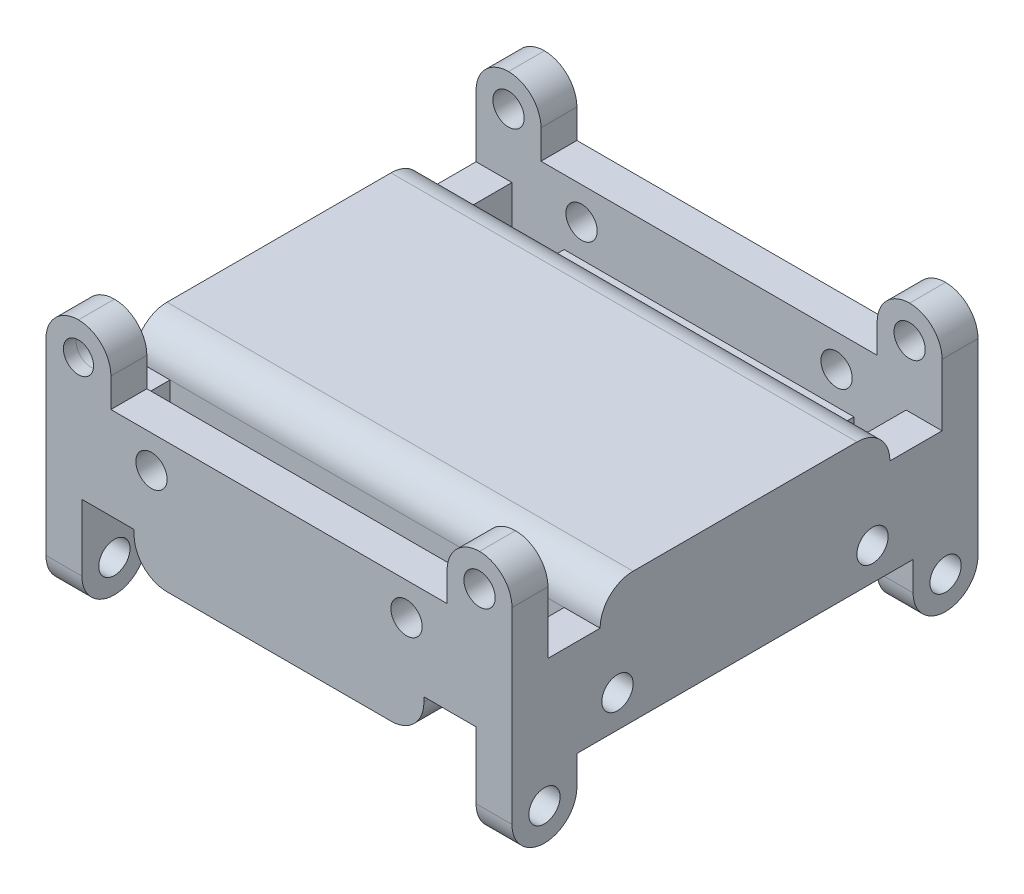
from build123d import *

# Parameters (mm, degrees)
ESBO_O1_R                  = 1.35
RESSALTO_EXTRUS_O1_DEPTH   = 2
ESBO_O3_W                  = 40.2
ESBO_O3_H                  = 2
RESSALTO_EXTRUS_O2_DEPTH   = 10.08
ESBO_O4_W                  = 3.1
ESBO_O4_H                  = 12.84
RESSALTO_EXTRUS_O3_DEPTH   = 34
CORTE_EXTRUS_O1_DEPTH      = 55.735280213
CORTE_EXTRUS_O1_DEPTH_BACK = 55.735280213
ESBO_O5_R                  = 1.35
ESBO_O7_W                  = 37.1
ESBO_O7_H                  = 3.24
CORTE_EXTRUS_O2_DEPTH      = 2
RESSALTO_EXTRUS_O5_START   = 2
ESBO_O12_R                 = 1.35
RESSALTO_EXTRUS_O5_DEPTH   = 2
ESBO_O18_W                 = 3.1
ESBO_O18_H                 = 3.24
RESSALTO_EXTRUS_O6_DEPTH   = 2
ESBO_O19_W                 = 3.1
ESBO_O19_H                 = 3.24
RESSALTO_EXTRUS_O7_DEPTH   = 2
ESBO_O21_R                 = 1.301764144
ESBO_O21_R_2               = 1.35
RESSALTO_EXTRUS_O8_DEPTH   = 1.1
RESSALTO_EXTRUS_O9_START   = 1.1
ESBO_O22_R                 = 1.35
RESSALTO_EXTRUS_O9_DEPTH   = 1.1
ESBO_O23_W                 = 3.1
ESBO_O23_H                 = 5.6
RESSALTO_EXTRUS_O10_DEPTH  = 5.85
CORTE_EXTRUS_O3_REACH      = 63.173
ESBO_O24_R                 = 1.35
ESBO_O25_W                 = 4.5
ESBO_O25_H                 = 3.1
CORTE_EXTRUS_O6_DEPTH      = 4.48
ESBO_O27_W                 = 3.1
ESBO_O27_H                 = 29
CORTE_EXTRUS_O7_DEPTH      = 4.48
ESBO_O28_W                 = 25
ESBO_O28_H                 = 40.2
CORTE_EXTRUS_O8_DEPTH      = 1.24
ESBO_O29_W                 = 25
ESBO_O29_H                 = 5.6
RESSALTO_EXTRUS_O11_DEPTH  = 34
ESBO_O31_W                 = 3.1
ESBO_O31_H                 = 25
RESSALTO_EXTRUS_O12_DEPTH  = 2.84
ESBO_O32_W                 = 25
ESBO_O32_H                 = 5.6
RESSALTO_EXTRUS_O13_DEPTH  = 34
FILETE1_R                  = 2.84
ESBO_O33_W                 = 5.6
ESBO_O33_H                 = 3.1
CORTE_EXTRUS_O9_DEPTH      = 0.55
ESBO_O35_W                 = 3.1
ESBO_O35_H                 = 5.6
CORTE_EXTRUS_O10_DEPTH     = 5.03
FILETE2_R                  = 2.8


with BuildPart() as part:
    # Esboço1 → Ressalto-extrusão1 (new body)
    with BuildSketch(Plane.XY):
        Polygon((0, 0), (5.6, 0), (5.6, -5.85), (34.6, -5.85), (34.6, 0), (40.2, 0), (40.2, -11.45), (0, -11.45), align=None)
        with Locations((2.8, -3.35)):
            Circle(ESBO_O1_R, mode=Mode.SUBTRACT)
        with Locations((37.4, -3.35)):
            Circle(ESBO_O1_R, mode=Mode.SUBTRACT)
        with Locations((31.1, -8.65)):
            Circle(ESBO_O1_R, mode=Mode.SUBTRACT)
        with Locations((9.1, -8.65)):
            Circle(ESBO_O1_R, mode=Mode.SUBTRACT)
    extrude(amount=RESSALTO_EXTRUS_O1_DEPTH)

    # Esboço3 → Ressalto-extrusão2 (add)
    with BuildSketch(Plane.XZ.offset(11.45)):
        with Locations((20.1, 1)):
            Rectangle(ESBO_O3_W, ESBO_O3_H)
    extrude(amount=RESSALTO_EXTRUS_O2_DEPTH)

    # Esboço4 → Ressalto-extrusão3 (add)
    with BuildSketch(Plane(origin=(0, 0, 0), x_dir=(-1, 0, 0), z_dir=(0, 0, -1))):
        with Locations((-38.65, -15.11)):
            Rectangle(ESBO_O4_W, ESBO_O4_H)
        with Locations((-1.55, -15.11)):
            Rectangle(ESBO_O4_W, ESBO_O4_H)
    extrude(amount=RESSALTO_EXTRUS_O3_DEPTH)

    # Esboço5 → Corte-extrusão1 (cut, two sides: drawn at the far end of the back side and taken through both)
    with BuildSketch(Plane.ZY.offset(-37.1).offset(-CORTE_EXTRUS_O1_DEPTH_BACK)):
        with Locations((-6, -14.25)):
            Circle(ESBO_O5_R)
        with Locations((-28, -14.25)):
            Circle(ESBO_O5_R)
    extrude(amount=CORTE_EXTRUS_O1_DEPTH + CORTE_EXTRUS_O1_DEPTH_BACK, mode=Mode.SUBTRACT)

    # Esboço7 → Corte-extrusão2 (cut)
    with BuildSketch(Plane(origin=(0, 0, 0), x_dir=(-1, 0, 0), z_dir=(0, 0, -1))):
        with Locations((-18.55, -19.91)):
            Rectangle(ESBO_O7_W, ESBO_O7_H)
    extrude(amount=-CORTE_EXTRUS_O2_DEPTH, mode=Mode.SUBTRACT)

    # Esboço12 → Ressalto-extrusão5 (add)
    with BuildSketch(Plane(origin=(0, 0, -34), x_dir=(-1, 0, 0), z_dir=(0, 0, -1)).offset(RESSALTO_EXTRUS_O5_START)):
        Polygon((-5.6, 0), (0, 0), (0, -18.29), (-40.2, -18.29), (-40.2, 0), (-34.6, 0), (-34.6, -5.85), (-5.6, -5.85), align=None)
        with Locations(Location((-31.1, -8.65, 0), (0, 0, 180))):
            Circle(ESBO_O12_R, mode=Mode.SUBTRACT)
        with Locations(Location((-9.1, -8.65, 0), (0, 0, 180))):
            Circle(ESBO_O12_R, mode=Mode.SUBTRACT)
        with Locations(Location((-2.8, -3.35, 0), (0, 0, 180))):
            Circle(ESBO_O12_R, mode=Mode.SUBTRACT)
        with Locations(Location((-37.4, -3.35, 0), (0, 0, 180))):
            Circle(ESBO_O12_R, mode=Mode.SUBTRACT)
    extrude(amount=-RESSALTO_EXTRUS_O5_DEPTH)

    # Esboço18 → Ressalto-extrusão6 (add)
    with BuildSketch(Plane.XY):
        with Locations((1.55, -19.91)):
            Rectangle(ESBO_O18_W, ESBO_O18_H)
    extrude(amount=RESSALTO_EXTRUS_O6_DEPTH)

    # Esboço19 → Ressalto-extrusão7 (add)
    with BuildSketch(Plane(origin=(0, 0, -34), x_dir=(-1, 0, 0), z_dir=(0, 0, -1))):
        with Locations((-1.55, -19.91)):
            Rectangle(ESBO_O19_W, ESBO_O19_H)
        with Locations((-38.65, -19.91)):
            Rectangle(ESBO_O19_W, ESBO_O19_H)
    extrude(amount=RESSALTO_EXTRUS_O7_DEPTH)

    # Esboço21 → Ressalto-extrusão8 (add)
    with BuildSketch(Plane.XY.offset(2)):
        Polygon((37.1, -21.53), (40.2, -21.53), (40.2, 0), (34.6, 0), (34.6, -5.85), (5.6, -5.85), (5.6, 0), (0, 0), (0, -21.53), (3.1, -21.53), (3.1, -18.29), (37.1, -18.29), align=None)
        with Locations((2.8, -3.35)):
            Circle(ESBO_O21_R, mode=Mode.SUBTRACT)
        with Locations((9.1, -8.65)):
            Circle(ESBO_O21_R_2, mode=Mode.SUBTRACT)
        with Locations((31.1, -8.65)):
            Circle(ESBO_O21_R_2, mode=Mode.SUBTRACT)
        with Locations((37.4, -3.35)):
            Circle(ESBO_O21_R_2, mode=Mode.SUBTRACT)
    extrude(amount=RESSALTO_EXTRUS_O8_DEPTH)

    # Esboço22 → Ressalto-extrusão9 (add)
    with BuildSketch(Plane(origin=(0, 0, -36), x_dir=(-1, 0, 0), z_dir=(0, 0, -1)).offset(RESSALTO_EXTRUS_O9_START)):
        Polygon((-5.6, 0), (0, 0), (0, -21.53), (-3.1, -21.53), (-3.1, -18.29), (-37.1, -18.29), (-37.1, -21.53), (-40.2, -21.53), (-40.2, 0), (-34.6, 0), (-34.6, -5.85), (-5.6, -5.85), align=None)
        with Locations(Location((-37.4, -3.35, 0), (0, 0, 180))):
            Circle(ESBO_O22_R, mode=Mode.SUBTRACT)
        with Locations(Location((-31.1, -8.65, 0), (0, 0, 180))):
            Circle(ESBO_O22_R, mode=Mode.SUBTRACT)
        with Locations(Location((-9.1, -8.65, 0), (0, 0, 180))):
            Circle(ESBO_O22_R, mode=Mode.SUBTRACT)
        with Locations(Location((-2.8, -3.35, 0), (0, 0, 180))):
            Circle(ESBO_O22_R, mode=Mode.SUBTRACT)
    extrude(amount=-RESSALTO_EXTRUS_O9_DEPTH)

    # Esboço23 → Ressalto-extrusão10 (add)
    with BuildSketch(Plane.XZ.offset(21.53)):
        with Locations((1.55, 0.3)):
            Rectangle(ESBO_O23_W, ESBO_O23_H)
        with Locations((1.55, -34.3)):
            Rectangle(ESBO_O23_W, ESBO_O23_H)
        with Locations((38.65, -34.3)):
            Rectangle(ESBO_O23_W, ESBO_O23_H)
        with Locations((38.65, 0.3)):
            Rectangle(ESBO_O23_W, ESBO_O23_H)
    extrude(amount=RESSALTO_EXTRUS_O10_DEPTH)

    # Corte-extrusão3: up to this face of the body (flat: up to its plane)
    corte_extrus_o3_end = Plane(part.part.faces().sort_by_distance((40.2, -15.177512698, -17))[0])
    # Esboço24 → Corte-extrusão3 (cut, up to the picked face)
    with BuildSketch(Plane.ZY, mode=Mode.PRIVATE) as corte_extrus_o3_sk1:
        with Locations(Location((-34.3, -19.55, 0), (0, 0, 270))):
            Circle(ESBO_O24_R)
    corte_extrus_o3_tool1 = split(extrude(corte_extrus_o3_sk1.sketch, amount=-CORTE_EXTRUS_O3_REACH, mode=Mode.PRIVATE), bisect_by=corte_extrus_o3_end, keep=Keep.BOTH, mode=Mode.PRIVATE)
    # Esboço24 → Corte-extrusão3 (cut, up to the picked face)
    with BuildSketch(Plane.ZY, mode=Mode.PRIVATE) as corte_extrus_o3_sk2:
        with Locations(Location((0.3, -19.55, 0), (0, 0, 270))):
            Circle(ESBO_O24_R)
    corte_extrus_o3_tool2 = split(extrude(corte_extrus_o3_sk2.sketch, amount=-CORTE_EXTRUS_O3_REACH, mode=Mode.PRIVATE), bisect_by=corte_extrus_o3_end, keep=Keep.BOTH, mode=Mode.PRIVATE)
    add(corte_extrus_o3_tool1.solids().sort_by(Axis((0, -19.55, -34.3), (1, 0, 0)))[0], mode=Mode.SUBTRACT)
    add(corte_extrus_o3_tool2.solids().sort_by(Axis((0, -19.55, 0.3), (1, 0, 0)))[0], mode=Mode.SUBTRACT)

    # Esboço25 → Corte-extrusão6 (cut)
    with BuildSketch(Plane.XZ.offset(18.29)):
        with Locations((5.35, -35.55)):
            Rectangle(ESBO_O25_W, ESBO_O25_H)
        with Locations((34.85, -35.55)):
            Rectangle(ESBO_O25_W, ESBO_O25_H)
        with Locations((34.85, 1.55)):
            Rectangle(ESBO_O25_W, ESBO_O25_H)
        with Locations((5.35, 1.55)):
            Rectangle(ESBO_O25_W, ESBO_O25_H)
    extrude(amount=-CORTE_EXTRUS_O6_DEPTH, mode=Mode.SUBTRACT)

    # Esboço27 → Corte-extrusão7 (cut)
    with BuildSketch(Plane.XZ.offset(21.53)):
        with Locations((1.55, -17)):
            Rectangle(ESBO_O27_W, ESBO_O27_H)
        with Locations((38.65, -17)):
            Rectangle(ESBO_O27_W, ESBO_O27_H)
    extrude(amount=-CORTE_EXTRUS_O7_DEPTH, mode=Mode.SUBTRACT)

    # Esboço28 → Corte-extrusão8 (cut)
    with BuildSketch(Plane.XZ.offset(18.29)):
        with Locations((20.1, -17)):
            Rectangle(ESBO_O28_W, ESBO_O28_H)
    extrude(amount=-CORTE_EXTRUS_O8_DEPTH, mode=Mode.SUBTRACT)

    # Esboço29 → Ressalto-extrusão11 (add)
    with BuildSketch(Plane.XY.offset(-34)):
        with Locations((20.1, -14.25)):
            Rectangle(ESBO_O29_W, ESBO_O29_H)
    extrude(amount=RESSALTO_EXTRUS_O11_DEPTH)

    # Esboço31 → Ressalto-extrusão12 (add)
    with BuildSketch(Plane(origin=(0, -8.69, 0), x_dir=(1, 0, 0), z_dir=(0, 1, 0))):
        with Locations((1.55, 17)):
            Rectangle(ESBO_O31_W, ESBO_O31_H)
        with Locations((38.65, 17)):
            Rectangle(ESBO_O31_W, ESBO_O31_H)
    extrude(amount=RESSALTO_EXTRUS_O12_DEPTH)

    # Esboço32 → Ressalto-extrusão13 (add)
    with BuildSketch(Plane.ZY.offset(-37.1)):
        with Locations((-17, -8.65)):
            Rectangle(ESBO_O32_W, ESBO_O32_H)
    extrude(amount=RESSALTO_EXTRUS_O13_DEPTH)

    # Filete1
    filete1_edges = [part.edges().sort_by_distance(p)[0] for p in [
        (32.6, -17.05, -17),
        (7.6, -17.05, -17),
        (20.1, -5.85, -29.5),
        (20.1, -5.85, -4.5),
    ]]
    fillet(filete1_edges, radius=FILETE1_R)

    # Esboço33 → Corte-extrusão9 (cut)
    with BuildSketch(Plane(origin=(0, 0, 0), x_dir=(1, 0, 0), z_dir=(0, 1, 0))):
        with Locations((2.8, 35.55)):
            Rectangle(ESBO_O33_W, ESBO_O33_H)
        with Locations((37.4, 35.55)):
            Rectangle(ESBO_O33_W, ESBO_O33_H)
        with Locations((37.4, -1.55)):
            Rectangle(ESBO_O33_W, ESBO_O33_H)
        with Locations((2.8, -1.55)):
            Rectangle(ESBO_O33_W, ESBO_O33_H)
    extrude(amount=-CORTE_EXTRUS_O9_DEPTH, mode=Mode.SUBTRACT)

    # Esboço35 → Corte-extrusão10 (cut)
    with BuildSketch(Plane.XZ.offset(27.38)):
        with Locations((1.55, 0.3)):
            Rectangle(ESBO_O35_W, ESBO_O35_H)
        with Locations((38.65, 0.3)):
            Rectangle(ESBO_O35_W, ESBO_O35_H)
        with Locations((38.65, -34.3)):
            Rectangle(ESBO_O35_W, ESBO_O35_H)
        with Locations((1.55, -34.3)):
            Rectangle(ESBO_O35_W, ESBO_O35_H)
    extrude(amount=-CORTE_EXTRUS_O10_DEPTH, mode=Mode.SUBTRACT)

    # Filete2
    filete2_edges = [part.edges().sort_by_distance(p)[0] for p in [
        (34.6, -0.55, 1.55),
        (40.2, -0.55, 1.55),
        (0, -0.55, 1.55),
        (5.6, -0.55, 1.55),
        (40.2, -0.55, -35.55),
        (34.6, -0.55, -35.55),
        (5.6, -0.55, -35.55),
        (0, -0.55, -35.55),
        (1.55, -22.35, -31.5),
        (1.55, -22.35, -37.1),
        (38.65, -22.35, -37.1),
        (38.65, -22.35, -31.5),
        (38.65, -22.35, -2.5),
        (38.65, -22.35, 3.1),
        (1.55, -22.35, -2.5),
        (1.55, -22.35, 3.1),
    ]]
    fillet(filete2_edges, radius=FILETE2_R - 0.0001)  # a hair under: the kernel refuses the full size


solid = part.part
